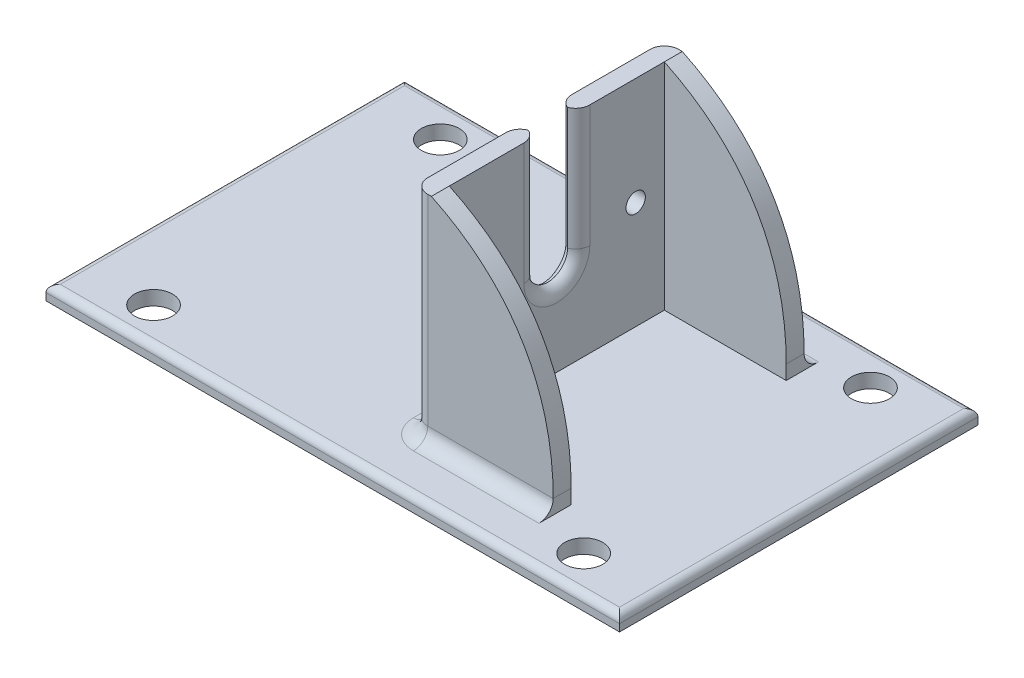
from build123d import *

# Parameters (mm, degrees)
SKETCH_2_W          = 80
SKETCH_2_H          = 50
SKETCH_2_R          = 2.65
EXTRUDE_1_DEPTH     = 2
SKETCH_3_W          = 2.5
SKETCH_3_H          = 35
SKETCH_3_W_2        = 17
SKETCH_3_H_2        = 2.5
EXTRUDE_2_DEPTH     = 30
CUT_EXTRUDE_1_REACH = 61.691
SKETCH_4_R          = 1.35
SKETCH_4_W          = 5.2
SKETCH_4_H          = 17
FILLET_1_R          = 2
FILLET_2_R          = 1
CUT_EXTRUDE_2_DEPTH = 67.560123197


with BuildPart() as part:
    # 草图2 → 凸台-拉伸1 (new body)
    with BuildSketch(Plane(origin=(0, 0, 0), x_dir=(1, 0, 0), z_dir=(0, 1, 0))):
        Rectangle(SKETCH_2_W, SKETCH_2_H)
        with Locations(Location((-30, 20, 0), (0, 0, 270))):
            Circle(SKETCH_2_R, mode=Mode.SUBTRACT)
        with Locations(Location((30, 20, 0), (0, 0, 90))):
            Circle(SKETCH_2_R, mode=Mode.SUBTRACT)
        with Locations(Location((-30, -20, 0), (0, 0, 90))):
            Circle(SKETCH_2_R, mode=Mode.SUBTRACT)
        with Locations(Location((30, -20, 0), (0, 0, 270))):
            Circle(SKETCH_2_R, mode=Mode.SUBTRACT)
    extrude(amount=EXTRUDE_1_DEPTH)

    # 草图3 → 凸台-拉伸2 (add)
    with BuildSketch(Plane(origin=(0, 2, 0), x_dir=(1, 0, 0), z_dir=(0, 1, 0))):
        with Locations((5, 0)):
            Rectangle(SKETCH_3_W, SKETCH_3_H)
        with Locations((14.75, 16.25)):
            Rectangle(SKETCH_3_W_2, SKETCH_3_H_2)
        with Locations((14.75, -16.25)):
            Rectangle(SKETCH_3_W_2, SKETCH_3_H_2)
    extrude(amount=EXTRUDE_2_DEPTH)

    # 草图4 → 切除-拉伸1 (cut, up to next)
    with BuildSketch(Plane.ZY.offset(-3.75), mode=Mode.PRIVATE) as cut_extrude_1_sk1:
        with Locations((11, 17)):
            Circle(SKETCH_4_R)
    cut_extrude_1_tool1 = extrude(cut_extrude_1_sk1.sketch, amount=-CUT_EXTRUDE_1_REACH, mode=Mode.PRIVATE) & part.part
    # 草图4 → 切除-拉伸1 (cut, up to next)
    with BuildSketch(Plane.ZY.offset(-3.75), mode=Mode.PRIVATE) as cut_extrude_1_sk2:
        with Locations((-11, 17)):
            Circle(SKETCH_4_R)
    cut_extrude_1_tool2 = extrude(cut_extrude_1_sk2.sketch, amount=-CUT_EXTRUDE_1_REACH, mode=Mode.PRIVATE) & part.part
    # 草图4 → 切除-拉伸1 (cut, up to next)
    with BuildSketch(Plane.ZY.offset(-3.75), mode=Mode.PRIVATE) as cut_extrude_1_sk3:
        with Locations((0, 23.5)):
            Rectangle(SKETCH_4_W, SKETCH_4_H)
    cut_extrude_1_tool3 = extrude(cut_extrude_1_sk3.sketch, amount=-CUT_EXTRUDE_1_REACH, mode=Mode.PRIVATE) & part.part
    # 草图4 → 切除-拉伸1 (cut, up to next)
    with BuildSketch(Plane.ZY.offset(-3.75), mode=Mode.PRIVATE) as cut_extrude_1_sk4:
        with BuildLine():
            Line((-2.6, 15), (2.6, 15))
            ThreePointArc((2.6, 15), (0, 12.4), (-2.6, 15))
        make_face()
    cut_extrude_1_tool4 = extrude(cut_extrude_1_sk4.sketch, amount=-CUT_EXTRUDE_1_REACH, mode=Mode.PRIVATE) & part.part
    add(cut_extrude_1_tool1.solids().sort_by_distance((3.75, 17, 11))[0], mode=Mode.SUBTRACT)
    add(cut_extrude_1_tool2.solids().sort_by_distance((3.75, 17, -11))[0], mode=Mode.SUBTRACT)
    add(cut_extrude_1_tool3.solids().sort_by_distance((3.75, 23.5, 0))[0], mode=Mode.SUBTRACT)
    add(cut_extrude_1_tool4.solids().sort_by_distance((3.75, 13.896526, 0))[0], mode=Mode.SUBTRACT)

    # 圆角1
    # the kernel refuses this fillet: 2 mm, written as the material it takes off along each edge
    with BuildSketch(Plane(origin=(6.25, 37, 2.6), x_dir=(0, 0, 1), z_dir=(0, -1, 0)), Plane(origin=(6.25, 15, -2.6), x_dir=(0, 0, -1), z_dir=(0, 1, 0)), Plane(origin=(3.75, 37, -2.6), x_dir=(0, 0, -1), z_dir=(0, -1, 0)), Plane(origin=(3.75, 15, 2.6), x_dir=(0, 0, 1), z_dir=(0, 1, 0))) as fillet_1_piece_1:
        with BuildLine():
            CenterArc((FILLET_1_R, FILLET_1_R), FILLET_1_R, 180, 90)
            Line((0, FILLET_1_R), (0, 0))
            Line((0, 0), (FILLET_1_R, 0))
        make_face()
    extrude(amount=22, mode=Mode.SUBTRACT)
    with BuildSketch(Plane(origin=(6.25, 15, 0), x_dir=(0, 0, -1), z_dir=(0, 1, 0))) as fillet_1_piece_2:
        with BuildLine():
            CenterArc((2.6 + FILLET_1_R, FILLET_1_R), FILLET_1_R, 180, 90)
            Line((2.6, FILLET_1_R), (2.6, 0))
            Line((2.6, 0), (2.6 + FILLET_1_R, 0))
        make_face()
    revolve(axis=Axis((6.25, 15, 0), (-1, 0, 0)), revolution_arc=180, mode=Mode.SUBTRACT)
    with BuildSketch(Plane(origin=(3.75, 15, 0), x_dir=(0, 0, 1), z_dir=(0, 1, 0))) as fillet_1_piece_3:
        with BuildLine():
            CenterArc((2.6 + FILLET_1_R, FILLET_1_R), FILLET_1_R, 180, 90)
            Line((2.6, FILLET_1_R), (2.6, 0))
            Line((2.6, 0), (2.6 + FILLET_1_R, 0))
        make_face()
    revolve(axis=Axis((3.75, 15, 0), (1, 0, 0)), revolution_arc=180, mode=Mode.SUBTRACT)
    with BuildSketch(Plane(origin=(3.75, 2, -17.5), x_dir=(1, 0, 0), z_dir=(0, 1, 0))) as fillet_1_piece_4:
        with BuildLine():
            CenterArc((FILLET_1_R, -FILLET_1_R), FILLET_1_R, 90, 90)
            Line((0, -FILLET_1_R), (0, 0))
            Line((0, 0), (FILLET_1_R, 0))
        make_face()
    extrude(amount=35, mode=Mode.SUBTRACT)
    with BuildSketch(Plane(origin=(3.75, 2, 17.5), x_dir=(1, 0, 0), z_dir=(0, 1, 0))) as fillet_1_piece_5:
        with BuildLine():
            CenterArc((FILLET_1_R, FILLET_1_R), FILLET_1_R, 180, 90)
            Line((0, FILLET_1_R), (0, 0))
            Line((0, 0), (FILLET_1_R, 0))
        make_face()
    extrude(amount=35, mode=Mode.SUBTRACT)
    # the kernel refuses this fillet: 2 mm, written as the material it adds along each edge
    with BuildSketch(Plane(origin=(5.75, 2, 17.5), x_dir=(0, 0, 1), z_dir=(1, 0, 0))) as fillet_1_2_piece_1:
        with BuildLine():
            CenterArc((FILLET_1_R, -FILLET_1_R), FILLET_1_R, 90, 90)
            Line((0, -FILLET_1_R), (0, 0))
            Line((0, 0), (FILLET_1_R, 0))
        make_face()
    extrude(amount=17.5)
    with BuildSketch(Plane(origin=(5.75, 2, -17.5), x_dir=(0, 0, -1), z_dir=(1, 0, 0))) as fillet_1_2_piece_2:
        with BuildLine():
            CenterArc((FILLET_1_R, FILLET_1_R), FILLET_1_R, 180, 90)
            Line((0, FILLET_1_R), (0, 0))
            Line((0, 0), (FILLET_1_R, 0))
        make_face()
    extrude(amount=17.5)
    with BuildSketch(Plane(origin=(3.75, 2, -15.5), x_dir=(-1, 0, 0), z_dir=(0, 0, 1))) as fillet_1_2_piece_3:
        with BuildLine():
            CenterArc((FILLET_1_R, -FILLET_1_R), FILLET_1_R, 90, 90)
            Line((0, -FILLET_1_R), (0, 0))
            Line((0, 0), (FILLET_1_R, 0))
        make_face()
    extrude(amount=31)
    with BuildSketch(Plane(origin=(5.75, 2, -15.5), x_dir=(0, 0, -1), z_dir=(1, 0, 0))) as fillet_1_2_piece_4:
        with BuildLine():
            CenterArc((2 + FILLET_1_R, FILLET_1_R), FILLET_1_R, 180, 90)
            Line((2, FILLET_1_R), (2, 0))
            Line((2, 0), (2 + FILLET_1_R, 0))
        make_face()
    revolve(axis=Axis((5.75, 2, -15.5), (0, 1, 0)), revolution_arc=90)
    with BuildSketch(Plane(origin=(5.75, 2, 15.5), x_dir=(0, 0, 1), z_dir=(1, 0, 0))) as fillet_1_2_piece_5:
        with BuildLine():
            CenterArc((2 + FILLET_1_R, -FILLET_1_R), FILLET_1_R, 90, 90)
            Line((2, -FILLET_1_R), (2, 0))
            Line((2, 0), (2 + FILLET_1_R, 0))
        make_face()
    revolve(axis=Axis((5.75, 2, 15.5), (0, -1, 0)), revolution_arc=90)

    # 圆角2
    fillet_2_edges = [part.edges().sort_by_distance(p)[0] for p in [
        (-40, 2, 0),
        (0, 2, 25),
        (40, 2, 0),
        (0, 2, -25),
    ]]
    fillet(fillet_2_edges, radius=FILLET_2_R)

    # 草图5 → 切除-拉伸2 (cut, through all)
    with BuildSketch(Plane.XY.offset(17.5)):
        with BuildLine():
            Line((23.25, 32), (6.25, 32))
            add(Edge.make_bspline(
                [(6.25, 32), (16.534964458, 27.088669385), (23.25, 17.881434401), (23.25, 4)],
                knots=[0, 0, 0, 0, 1, 1, 1, 1], degree=3))
            Line((23.25, 4), (23.25, 32))
        make_face()
    extrude(amount=-CUT_EXTRUDE_2_DEPTH, mode=Mode.SUBTRACT)


solid = part.part
